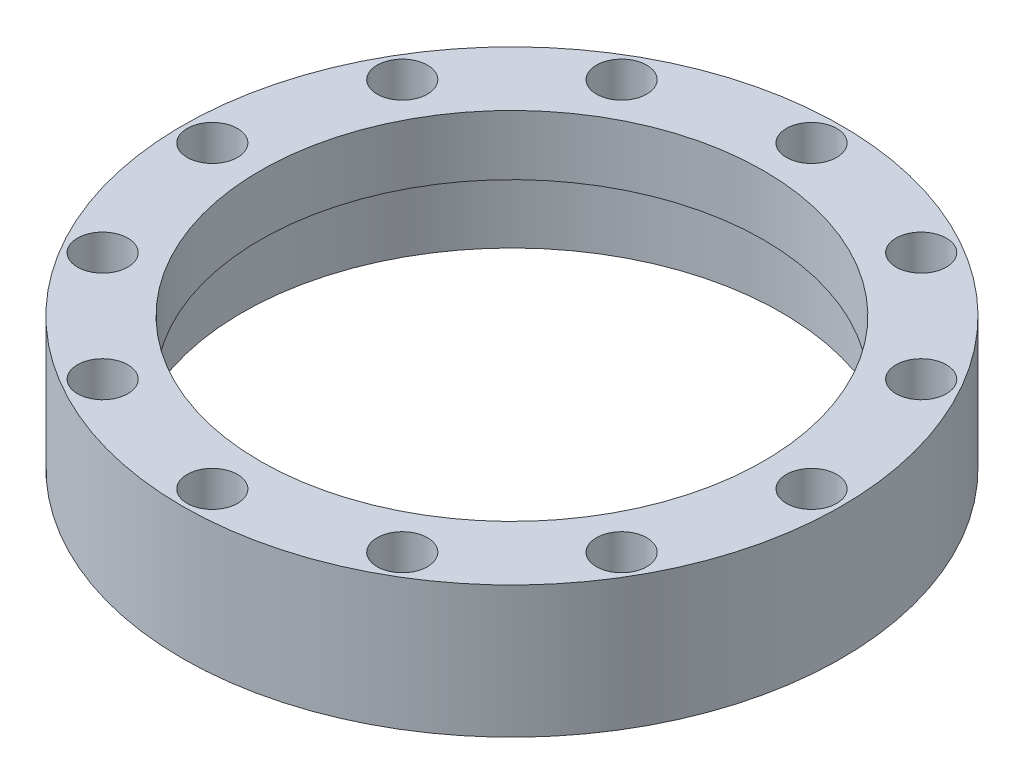
from build123d import *

# Parameters (mm, degrees)
SKETCH1_R           = 27.5
SKETCH1_R_2         = 22.5
SKETCH1_R_3         = 1.5
BOSS_EXTRUDE1_DEPTH = 11
BOSS_EXTRUDE2_START = -5
SKETCH2_R           = 22.5
SKETCH2_R_2         = 21
BOSS_EXTRUDE2_DEPTH = 5
SKETCH3_R           = 2.1
CUT_EXTRUDE1_DEPTH  = 5


with BuildPart() as part:
    # Sketch1 → Boss-Extrude1 (new body)
    with BuildSketch(Plane(origin=(0, 0, 0), x_dir=(1, 0, 0), z_dir=(0, 1, 0))):
        Circle(SKETCH1_R)
        Circle(SKETCH1_R_2, mode=Mode.SUBTRACT)
        with Locations((0, 25)):
            Circle(SKETCH1_R_3, mode=Mode.SUBTRACT)
        with Locations((12.5, 21.650635095)):
            Circle(SKETCH1_R_3, mode=Mode.SUBTRACT)
        with Locations((21.650635095, 12.5)):
            Circle(SKETCH1_R_3, mode=Mode.SUBTRACT)
        with Locations((25, 0)):
            Circle(SKETCH1_R_3, mode=Mode.SUBTRACT)
        with Locations((21.650635095, -12.5)):
            Circle(SKETCH1_R_3, mode=Mode.SUBTRACT)
        with Locations((12.5, -21.650635095)):
            Circle(SKETCH1_R_3, mode=Mode.SUBTRACT)
        with Locations((0, -25)):
            Circle(SKETCH1_R_3, mode=Mode.SUBTRACT)
        with Locations((-12.5, -21.650635095)):
            Circle(SKETCH1_R_3, mode=Mode.SUBTRACT)
        with Locations((-21.650635095, -12.5)):
            Circle(SKETCH1_R_3, mode=Mode.SUBTRACT)
        with Locations((-25, 0)):
            Circle(SKETCH1_R_3, mode=Mode.SUBTRACT)
        with Locations((-21.650635095, 12.5)):
            Circle(SKETCH1_R_3, mode=Mode.SUBTRACT)
        with Locations((-12.5, 21.650635095)):
            Circle(SKETCH1_R_3, mode=Mode.SUBTRACT)
    extrude(amount=BOSS_EXTRUDE1_DEPTH)

    # Sketch2 → Boss-Extrude2 (add)
    with BuildSketch(Plane(origin=(0, 11, 0), x_dir=(1, 0, 0), z_dir=(0, 1, 0)).offset(BOSS_EXTRUDE2_START)):
        Circle(SKETCH2_R)
        Circle(SKETCH2_R_2, mode=Mode.SUBTRACT)
    extrude(amount=BOSS_EXTRUDE2_DEPTH)

    # Sketch3 → Cut-Extrude1 (cut)
    with BuildSketch(Plane(origin=(0, 11, 0), x_dir=(1, 0, 0), z_dir=(0, 1, 0))):
        with Locations((0, 25)):
            Circle(SKETCH3_R)
        with Locations((12.5, 21.650635095)):
            Circle(SKETCH3_R)
        with Locations((21.650635095, 12.5)):
            Circle(SKETCH3_R)
        with Locations((25, 0)):
            Circle(SKETCH3_R)
        with Locations((21.650635095, -12.5)):
            Circle(SKETCH3_R)
        with Locations((12.5, -21.650635095)):
            Circle(SKETCH3_R)
        with Locations((0, -25)):
            Circle(SKETCH3_R)
        with Locations((-12.5, -21.650635095)):
            Circle(SKETCH3_R)
        with Locations((-21.650635095, -12.5)):
            Circle(SKETCH3_R)
        with Locations((-25, 0)):
            Circle(SKETCH3_R)
        with Locations((-21.650635095, 12.5)):
            Circle(SKETCH3_R)
        with Locations((-12.5, 21.650635095)):
            Circle(SKETCH3_R)
    extrude(amount=-CUT_EXTRUDE1_DEPTH, mode=Mode.SUBTRACT)


solid = part.part
